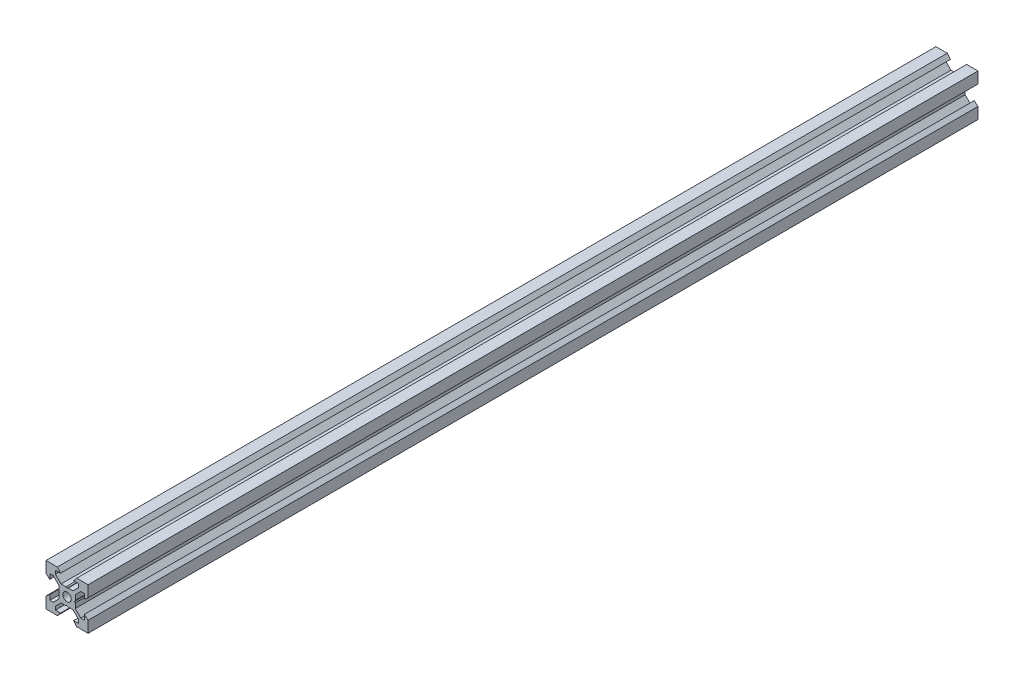
from build123d import *

# Parameters (mm, degrees)
SKETCH1_R           = 2
BOSS_EXTRUDE1_DEPTH = 211.42


with BuildPart() as part:
    # Sketch1 → Boss-Extrude1 (new, symmetric)
    with BuildSketch(Plane.XY):
        Polygon((10, 4.610379336), (10, 10), (4.610379336, 10), (3.1, 8.2), (5.5, 8.2), (5.5, 6.560660172), (2.839339828, 3.9), (0.519615242, 3.9), (0, 3.6), (-0.519615242, 3.9), (-2.839339828, 3.9), (-5.5, 6.560660172), (-5.5, 8.2), (-3.1, 8.2), (-4.610379336, 10), (-10, 10), (-10, 4.610379336), (-8.2, 3.1), (-8.2, 5.5), (-6.560660172, 5.5), (-3.9, 2.839339828), (-3.9, 0.519615242), (-3.6, 0), (-3.9, -0.519615242), (-3.9, -2.839339828), (-6.560660172, -5.5), (-8.2, -5.5), (-8.2, -3.1), (-10, -4.610379336), (-10, -10), (-4.610379336, -10), (-3.1, -8.2), (-5.5, -8.2), (-5.5, -6.560660172), (-2.839339828, -3.9), (-0.519615242, -3.9), (0, -3.6), (0.519615242, -3.9), (2.839339828, -3.9), (5.5, -6.560660172), (5.5, -8.2), (3.1, -8.2), (4.610379336, -10), (10, -10), (10, -4.610379336), (8.2, -3.1), (8.2, -5.5), (6.560660172, -5.5), (3.9, -2.839339828), (3.9, -0.519615242), (3.6, 0), (3.9, 0.519615242), (3.9, 2.839339828), (6.560660172, 5.5), (8.2, 5.5), (8.2, 3.1), align=None)
        Circle(SKETCH1_R, mode=Mode.SUBTRACT)
    extrude(amount=BOSS_EXTRUDE1_DEPTH, both=True)


solid = part.part
